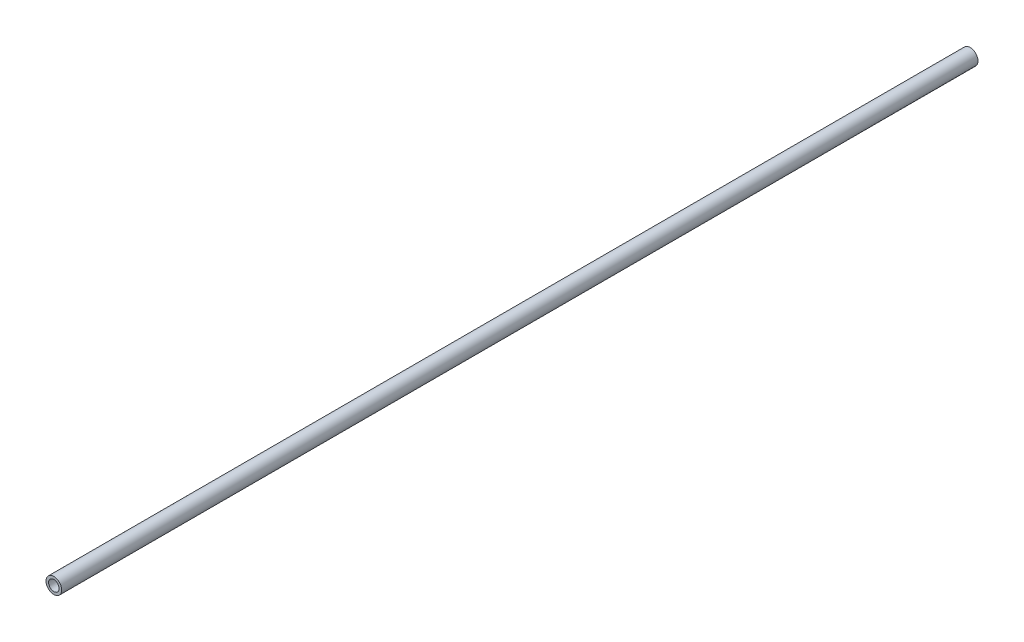
from build123d import *

# Parameters (mm, degrees)
SKETCH_1_R      = 3
SKETCH_1_R_2    = 2
EXTRUDE_1_DEPTH = 175


with BuildPart() as part:
    # Эскиз1 → Бобышка-Вытянуть1 (new, symmetric)
    with BuildSketch(Plane.XY):
        Circle(SKETCH_1_R)
        Circle(SKETCH_1_R_2, mode=Mode.SUBTRACT)
    extrude(amount=EXTRUDE_1_DEPTH, both=True)


solid = part.part
